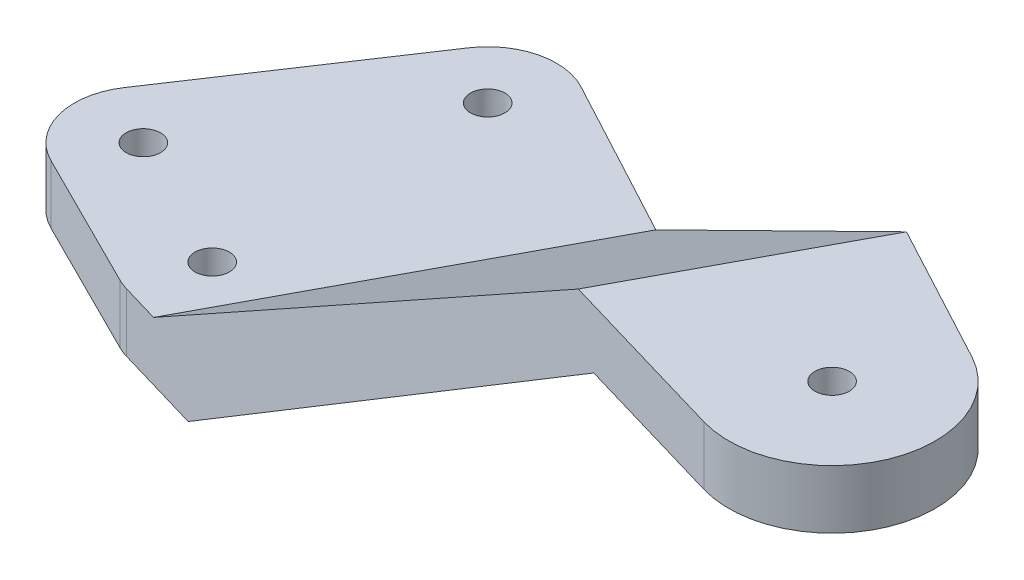
from build123d import *

# Parameters (mm, degrees)
BOSS_EXTRUDE1_DEPTH = 17
SKETCH2_R           = 2.5
CUT_EXTRUDE1_DEPTH  = 145.962064003
BOSS_EXTRUDE2_DEPTH = 51.5
SKETCH4_R           = 2.5
CUT_EXTRUDE2_DEPTH  = 160.427883383
CUT_EXTRUDE5_DEPTH  = 158.502587915
CUT_EXTRUDE6_DEPTH  = 158.502587915


with BuildPart() as part:
    # Sketch1 → Boss-Extrude1 (new body)
    with BuildSketch(Plane(origin=(0, 0, 0), x_dir=(1, 0, 0), z_dir=(0, 1, 0))):
        with BuildLine():
            Line((4.724564955, 48.813539923), (127.086847433, -16.779690115))
            ThreePointArc((127.086847433, -16.779690115), (133.880787219, -35.685397627), (115.776703796, -44.393184817))
            Line((115.776703796, -44.393184817), (-2.815530803, -9.595456545))
            ThreePointArc((-2.815530803, -9.595456545), (-3.658351002, -9.306796868), (-4.472135955, -8.94427191))
            Line((-4.472135955, -8.94427191), (-24.472135955, 1.05572809))
            ThreePointArc((-24.472135955, 1.05572809), (-29.664996488, 7.433320648), (-28.320502943, 15.547001962))
            Line((-28.320502943, 15.547001962), (-8.320502943, 45.547001962))
            ThreePointArc((-8.320502943, 45.547001962), (-2.429045094, 49.700502045), (4.724564955, 48.813539923))
        make_face()
    extrude(amount=BOSS_EXTRUDE1_DEPTH)

    # Sketch2 → Cut-Extrude1 (cut, through all)
    with BuildSketch(Plane(origin=(0, 17, 0), x_dir=(1, 0, 0), z_dir=(0, 1, 0))):
        with Locations((0, 40)):
            Circle(SKETCH2_R)
        Circle(SKETCH2_R)
        with Locations((120, -30)):
            Circle(SKETCH2_R)
        with Locations((-20, 10)):
            Circle(SKETCH2_R)
    extrude(amount=-CUT_EXTRUDE1_DEPTH, mode=Mode.SUBTRACT)

    # Sketch3 → Boss-Extrude2 (add)
    with BuildSketch(Plane(origin=(0, 17, 0), x_dir=(1, 0, 0), z_dir=(0, 1, 0))):
        with BuildLine():
            Line((-2.815530803, -9.595456545), (115.776703796, -44.393184817))
            ThreePointArc((115.776703796, -44.393184817), (133.880787219, -35.685397627), (127.086847433, -16.779690115))
            Line((127.086847433, -16.779690115), (4.724564955, 48.813539923))
            ThreePointArc((4.724564955, 48.813539923), (-2.429045094, 49.700502045), (-8.320502943, 45.547001962))
            Line((-8.320502943, 45.547001962), (-28.320502943, 15.547001962))
            ThreePointArc((-28.320502943, 15.547001962), (-29.664996488, 7.433320648), (-24.472135955, 1.05572809))
            Line((-24.472135955, 1.05572809), (-4.472135955, -8.94427191))
            ThreePointArc((-4.472135955, -8.94427191), (-3.658351002, -9.306796868), (-2.815530803, -9.595456545))
        make_face()
    extrude(amount=BOSS_EXTRUDE2_DEPTH)

    # Sketch4 → Cut-Extrude2 (cut, through all)
    with BuildSketch(Plane.XZ):
        with Locations((120, 30)):
            Circle(SKETCH4_R)
        with Locations((0, -40)):
            Circle(SKETCH4_R)
        with Locations((-20, -10)):
            Circle(SKETCH4_R)
        Circle(SKETCH4_R)
    extrude(amount=-CUT_EXTRUDE2_DEPTH, mode=Mode.SUBTRACT)

    # Sketch7 → Cut-Extrude5 (cut, through all)
    with BuildSketch(Plane(origin=(21.380621697, 0, -39.884934317), x_dir=(-0.8813539923470356, 0, -0.4724564955357707), z_dir=(0.47245649553577074, 0, -0.8813539923470356))):
        Polygon((32.305670398, 8.5), (-7.694329602, 8.5), (-96.694329602, 68.5), (33.305670398, 68.5), (33.305670398, 8.5), align=None)
    extrude(amount=-CUT_EXTRUDE5_DEPTH, mode=Mode.SUBTRACT)

    # Sketch8 → Cut-Extrude6 (cut, through all)
    with BuildSketch(Plane(origin=(21.380621697, 0, -39.884934317), x_dir=(-0.8813539923470356, 0, -0.4724564955357707), z_dir=(0.47245649553577074, 0, -0.8813539923470356))):
        Polygon((-14.936173948, 0), (-99.936173948, 60), (-134.936173948, 60), (-135.936173948, 60), (-135.936173948, 0), align=None)
    extrude(amount=-CUT_EXTRUDE6_DEPTH, mode=Mode.SUBTRACT)


solid = part.part
